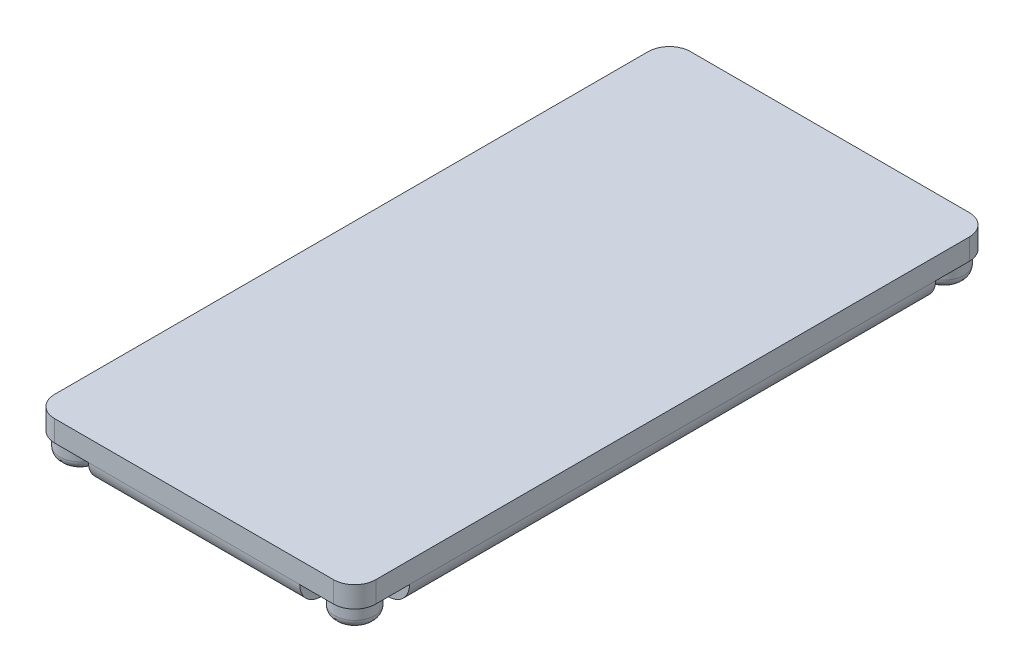
from build123d import *

# Parameters (mm, degrees)
SKETCH1_W            = 15.2
SKETCH1_H            = 30.1
BOSS_EXTRUDE1_DEPTH  = 2
CUT_EXTRUDE1_DEPTH   = 1
SKETCH5_R            = 0.95
BOSS_EXTRUDE3_DEPTH  = 1
FILLET2_R            = 0.4
CUT_EXTRUDE3_START   = 5.5499999
CUT_EXTRUDE3_DEPTH   = 1.9000002
CUT_EXTRUDE3_START_2 = -14.875049729
CUT_EXTRUDE3_2_DEPTH = 1.850099512
CUT_EXTRUDE3_START_3 = 6.468090347
CUT_EXTRUDE3_3_DEPTH = 0.063817292
FILLET3_R            = 1
FILLET4_R            = 1


with BuildPart() as part:
    # Sketch1 → Boss-Extrude1 (new body)
    with BuildSketch(Plane(origin=(0, 0, 0), x_dir=(1, 0, 0), z_dir=(0, 1, 0))):
        Rectangle(SKETCH1_W, SKETCH1_H)
    extrude(amount=BOSS_EXTRUDE1_DEPTH)

    # Sketch2 → Cut-Extrude1 (cut)
    with BuildSketch(Plane.XZ):
        with BuildLine():
            Line((7.6, -15.05), (5, -15.05))
            Line((5, -15.05), (5, -13.95))
            ThreePointArc((5, -13.95), (5.439339828, -12.889339828), (6.5, -12.45))
            Line((6.5, -12.45), (7.6, -12.45))
            Line((7.6, -12.45), (7.6, -15.05))
        make_face()
    extrude(amount=-CUT_EXTRUDE1_DEPTH, mode=Mode.SUBTRACT)

    # Sketch5 → Boss-Extrude3 (add)
    with BuildSketch(Plane.XZ.offset(-1)):
        with Locations(Location((6.5, -13.95, 0), (0, 0, 90))):
            Circle(SKETCH5_R)
    extrude(amount=BOSS_EXTRUDE3_DEPTH)

    # Fillet2
    fillet2_edges = [part.edges().sort_by_distance(p)[0] for p in [
        (6.5, 0, -14.9),
    ]]
    fillet(fillet2_edges, radius=FILLET2_R)

    # Cut-Extrude3: read off the stored shape, not the designer's step
    # Cut-Extrude3 outline → Cut-Extrude3 (cut)
    with BuildSketch(Plane.YZ.offset(CUT_EXTRUDE3_START)):
        Polygon((0, -14.044607759), (0.259932682, -13.95), (0, -13.855392241), align=None)
    extrude(amount=CUT_EXTRUDE3_DEPTH, mode=Mode.SUBTRACT)

    # Cut-Extrude3 2 outline → Cut-Extrude3 2 (cut)
    with BuildSketch(Plane.XY.offset(CUT_EXTRUDE3_START_2)):
        Polygon((6.627425302, 0), (6.5, 0.350098139), (6.372574698, 0), align=None)
    extrude(amount=CUT_EXTRUDE3_2_DEPTH, mode=Mode.SUBTRACT)

    # Cut-Extrude3 3 outline → Cut-Extrude3 3 (add)
    with BuildSketch(Plane.YZ.offset(CUT_EXTRUDE3_START_3)):
        Polygon((0.262432065, -13.024950217), (0.350098139, -13.056858059), (2, -13.657373235), (2, -13.024950217), align=None)
        Polygon((2, -14.875049729), (2, -14.24262677), (0.350098139, -14.843141941), (0.262432213, -14.875049729), align=None)
    extrude(amount=CUT_EXTRUDE3_3_DEPTH)

    # Mirror6: read off the stored shape, not the designer's step
    # Mirror6
    split(bisect_by=Plane(origin=(0, 0, 0), x_dir=(0, 0, 1), z_dir=(1, 0, 0)), keep=Keep.TOP)

    # Mirror6 2: part across plane


with BuildPart() as part_1:
    add(part.part)
    add(part.part.mirror(Plane(origin=(0, 0, 0), x_dir=(0, 0, 1), z_dir=(1, 0, 0))))

    # Mirror7: read off the stored shape, not the designer's step
    # Mirror7
    split(bisect_by=Plane.XY, keep=Keep.BOTTOM)

    # Mirror7 2: part across plane


with BuildPart() as part_2:
    add(part_1.part)
    add(part_1.part.mirror(Plane.XY))

    # Fillet3
    fillet3_edges = [part_2.edges().sort_by_distance(p)[0] for p in [
        (0, 0, -15.05),
        (-7.6, 0, 0),
        (0, 0, 15.05),
        (7.6, 0, 0),
    ]]
    fillet(fillet3_edges, radius=FILLET3_R)

    # Fillet4
    fillet4_edges = [part_2.edges().sort_by_distance(p)[0] for p in [
        (-7.6, 1.5, -15.05),
        (7.6, 1.5, -15.05),
        (7.6, 1.5, 15.05),
        (-7.6, 1.5, 15.05),
    ]]
    fillet(fillet4_edges, radius=FILLET4_R)


solid = part_2.part
